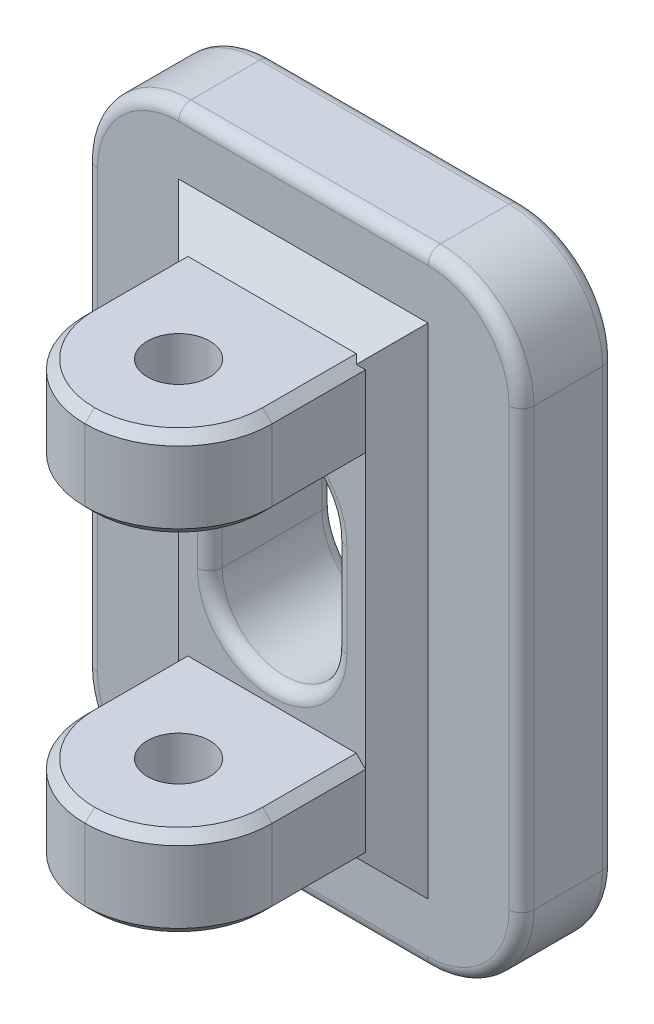
from build123d import *

# Parameters (mm, degrees)
BOSS_EXTRUDE1_DEPTH = 3
SKETCH2_W           = 6
SKETCH2_H           = 14
BOSS_EXTRUDE2_DEPTH = 1
SKETCH3_W           = 6
SKETCH3_H           = 2.9
BOSS_EXTRUDE3_DEPTH = 6
SKETCH4_R           = 1
CUT_EXTRUDE1_DEPTH  = 21.928449536
FILLET1_R           = 3
CHAMFER1_SIZE       = 1
CHAMFER2_SIZE       = 0.3
CUT_EXTRUDE2_DEPTH  = 14.601470509
FILLET2_R           = 0.4


with BuildPart() as part:
    # Sketch1 → Boss-Extrude1 (new body)
    with BuildSketch(Plane.XY):
        with BuildLine():
            Line((-4, -10), (4, -10))
            ThreePointArc((4, -10), (6.121320344, -9.121320344), (7, -7))
            Line((7, -7), (7, 7))
            ThreePointArc((7, 7), (6.121320344, 9.121320344), (4, 10))
            Line((4, 10), (-4, 10))
            ThreePointArc((-4, 10), (-6.121320344, 9.121320344), (-7, 7))
            Line((-7, 7), (-7, -7))
            ThreePointArc((-7, -7), (-6.121320344, -9.121320344), (-4, -10))
        make_face()
    extrude(amount=BOSS_EXTRUDE1_DEPTH)

    # Sketch2 → Boss-Extrude2 (add)
    with BuildSketch(Plane.XY.offset(3)):
        Rectangle(SKETCH2_W, SKETCH2_H)
    extrude(amount=BOSS_EXTRUDE2_DEPTH)

    # Sketch3 → Boss-Extrude3 (add)
    with BuildSketch(Plane.XY.offset(4)):
        with Locations((0, 5.55)):
            Rectangle(SKETCH3_W, SKETCH3_H)
        with Locations((0, -5.55)):
            Rectangle(SKETCH3_W, SKETCH3_H)
    extrude(amount=BOSS_EXTRUDE3_DEPTH)

    # Sketch4 → Cut-Extrude1 (cut, through all)
    with BuildSketch(Plane(origin=(0, 7, 0), x_dir=(1, 0, 0), z_dir=(0, 1, 0))):
        with Locations(Location((0, -7, 0), (0, 0, 90))):
            Circle(SKETCH4_R)
    extrude(amount=-CUT_EXTRUDE1_DEPTH, mode=Mode.SUBTRACT)

    # Fillet1
    fillet1_edges = [part.edges().sort_by_distance(p)[0] for p in [
        (3, -5.55, 10),
        (-3, -5.55, 10),
        (-3, 5.55, 10),
        (3, 5.55, 10),
    ]]
    fillet(fillet1_edges, radius=FILLET1_R - 0.0001)  # a hair under: the kernel refuses the full size

    # Chamfer1
    chamfer1_edges = [part.edges().sort_by_distance(p)[0] for p in [
        (3, 0, 3),
        (0, 7, 3),
        (-3, 0, 3),
        (0, -7, 3),
    ]]
    chamfer(chamfer1_edges, length=CHAMFER1_SIZE - 0.0001)  # a hair under: the kernel refuses the full size

    # Chamfer2
    chamfer2_edges = [part.edges().sort_by_distance(p)[0] for p in [
        (-3, -4.1, 5.50005),
        (3, -4.1, 5.50005),
        (-2.121349633, -4.1, 9.121349633),
        (2.121349633, -4.1, 9.121349633),
        (3, 7, 5.5),
        (3, 4.1, 5.50005),
        (3, -7, 5.5),
        (-3, -7, 5.5),
        (-2.121349633, -7, 9.121349633),
        (2.121349633, -7, 9.121349633),
        (-3, 4.1, 5.50005),
        (-3, 7, 5.5),
        (2.121349633, 4.1, 9.121349633),
        (-2.121349633, 4.1, 9.121349633),
        (2.121349633, 7, 9.121349633),
        (-2.121349633, 7, 9.121349633),
    ]]
    chamfer(chamfer2_edges, length=CHAMFER2_SIZE)

    # Sketch5 → Cut-Extrude2 (cut, through all)
    with BuildSketch(Plane.XY.offset(4)):
        with BuildLine():
            Line((-2, -1.5), (-2, 1.5))
            ThreePointArc((-2, 1.5), (0, 3.5), (2, 1.5))
            Line((2, 1.5), (2, -1.5))
            ThreePointArc((2, -1.5), (0, -3.5), (-2, -1.5))
        make_face()
    extrude(amount=-CUT_EXTRUDE2_DEPTH, mode=Mode.SUBTRACT)

    # Fillet2
    fillet2_edges = [part.edges().sort_by_distance(p)[0] for p in [
        (6.121320344, -9.121320344, 0),
        (7, 0, 0),
        (6.121320344, 9.121320344, 0),
        (0, 10, 0),
        (7, 0, 3),
        (6.121320344, -9.121320344, 3),
        (0, -3.5, 0),
        (-2, 0, 0),
        (0, 3.5, 0),
        (2, 0, 0),
        (0, -3.5, 4),
        (2, 0, 4),
        (0, 3.5, 4),
        (-2, 0, 4),
        (0, -10, 3),
        (-6.121320344, -9.121320344, 3),
        (-7, 0, 3),
        (-6.121320344, 9.121320344, 3),
        (0, 10, 3),
        (-6.121320344, 9.121320344, 0),
        (6.121320344, 9.121320344, 3),
        (-7, 0, 0),
        (-6.121320344, -9.121320344, 0),
        (0, -10, 0),
    ]]
    fillet(fillet2_edges, radius=FILLET2_R)


solid = part.part
